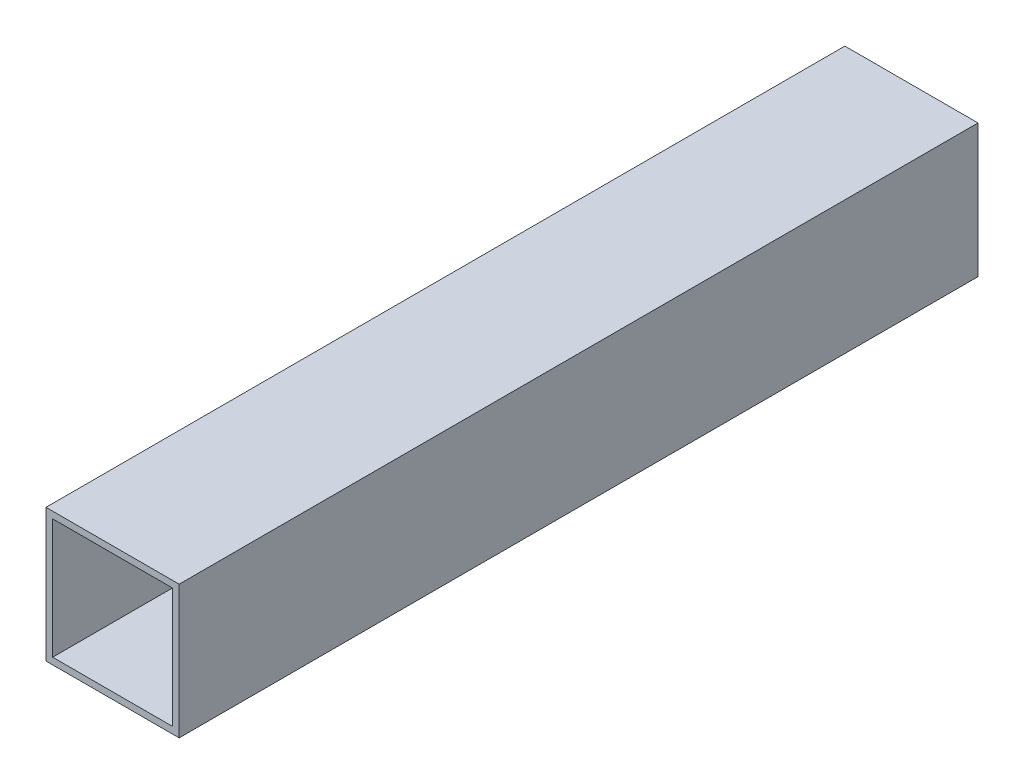
from build123d import *

# Parameters (mm, degrees)
ESQUISSE1_W        = 1000
ESQUISSE1_H        = 1000
ESQUISSE1_W_2      = 900
ESQUISSE1_H_2      = 900
BOSS_EXTRU_1_DEPTH = 6000


with BuildPart() as part:
    # Esquisse1 → Boss.-Extru.1 (new body)
    with BuildSketch(Plane.XY):
        Rectangle(ESQUISSE1_W, ESQUISSE1_H)
        Rectangle(ESQUISSE1_W_2, ESQUISSE1_H_2, mode=Mode.SUBTRACT)
    extrude(amount=BOSS_EXTRU_1_DEPTH)


solid = part.part
